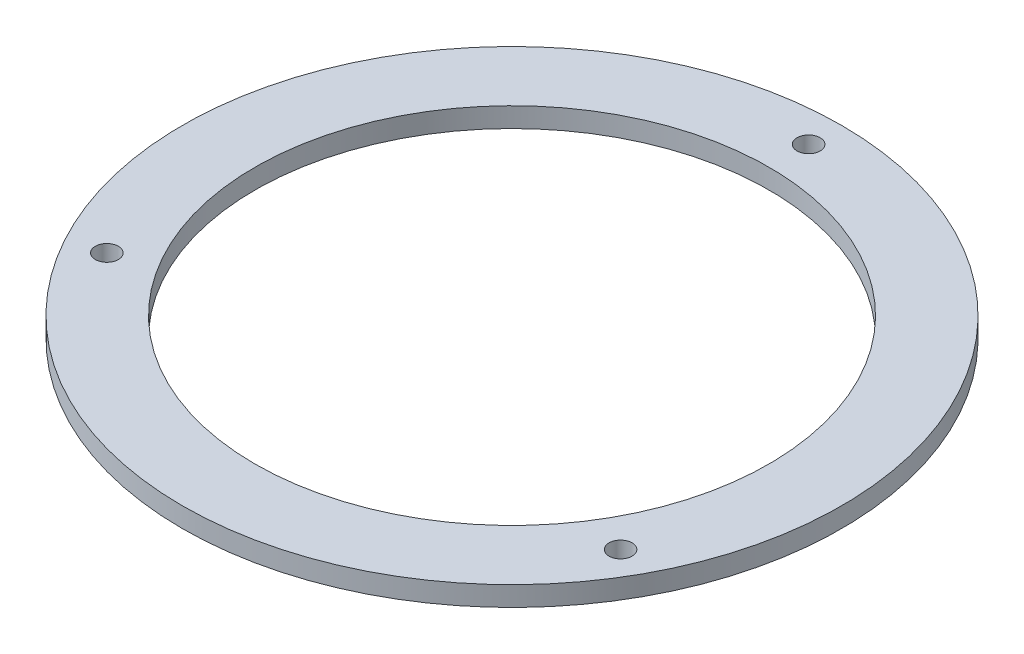
from build123d import *

# Parameters (mm, degrees)
SKETCH1_R           = 50
SKETCH1_R_2         = 39
SKETCH1_R_3         = 1.75
BOSS_EXTRUDE1_DEPTH = 3


with BuildPart() as part:
    # Sketch1 → Boss-Extrude1 (new body)
    with BuildSketch(Plane(origin=(0, 0, 0), x_dir=(1, 0, 0), z_dir=(0, 1, 0))):
        Circle(SKETCH1_R)
        Circle(SKETCH1_R_2, mode=Mode.SUBTRACT)
        with Locations((0, 45)):
            Circle(SKETCH1_R_3, mode=Mode.SUBTRACT)
        with Locations((38.97114317, -22.5)):
            Circle(SKETCH1_R_3, mode=Mode.SUBTRACT)
        with Locations((-38.97114317, -22.5)):
            Circle(SKETCH1_R_3, mode=Mode.SUBTRACT)
    extrude(amount=BOSS_EXTRUDE1_DEPTH)


solid = part.part
